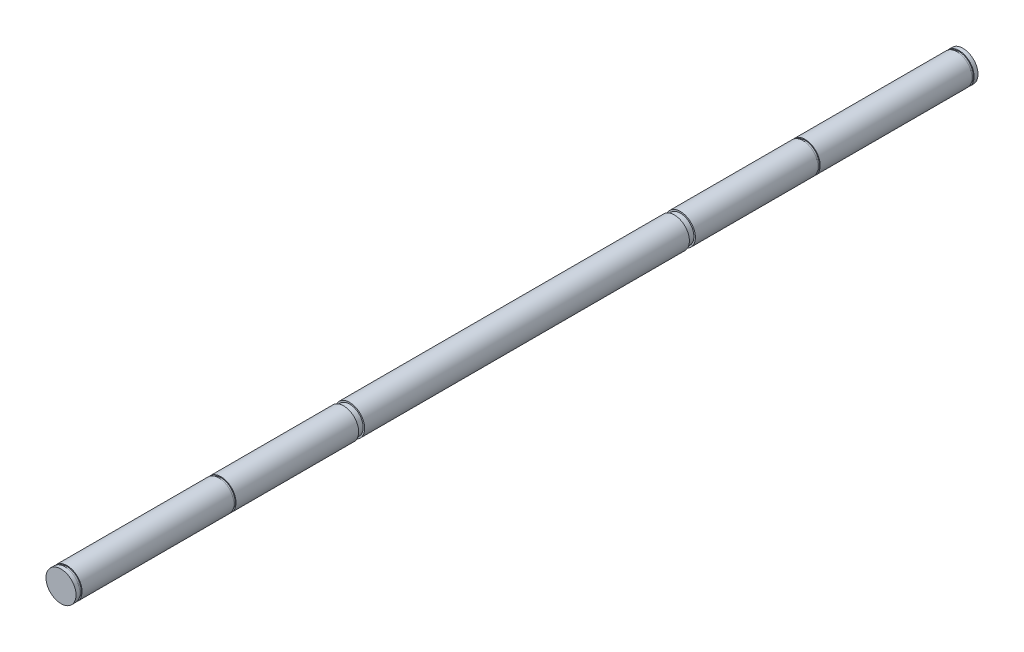
from build123d import *

# Parameters (mm, degrees)
SKETCH1_R           = 5
BOSS_EXTRUDE1_DEPTH = 150
CUT_EXTRUDE1_START  = 0.7
SKETCH2_R           = 5
SKETCH2_R_2         = 4.7
CUT_EXTRUDE1_DEPTH  = 0.7
SKETCH3_R           = 5
SKETCH3_R_2         = 4.7
CUT_EXTRUDE2_DEPTH  = 0.7
SKETCH4_R           = 5
SKETCH4_R_2         = 4.5
CUT_EXTRUDE3_DEPTH  = 1


with BuildPart() as part:
    # Sketch1 → Boss-Extrude1 (new, symmetric)
    with BuildSketch(Plane.XY):
        Circle(SKETCH1_R)
    extrude(amount=BOSS_EXTRUDE1_DEPTH, both=True)

    # Sketch2 → Cut-Extrude1 (cut)
    with BuildSketch(Plane.XY.offset(148).offset(CUT_EXTRUDE1_START)):
        Circle(SKETCH2_R)
        Circle(SKETCH2_R_2, mode=Mode.SUBTRACT)
    cut_extrude1 = extrude(amount=-CUT_EXTRUDE1_DEPTH, mode=Mode.SUBTRACT)

    # Sketch3 → Cut-Extrude2 (cut)
    with BuildSketch(Plane.XY.offset(97.5)):
        Circle(SKETCH3_R)
        Circle(SKETCH3_R_2, mode=Mode.SUBTRACT)
    cut_extrude2 = extrude(amount=-CUT_EXTRUDE2_DEPTH, mode=Mode.SUBTRACT)

    # Sketch4 → Cut-Extrude3 (cut, symmetric)
    with BuildSketch(Plane.XY.offset(55)):
        Circle(SKETCH4_R)
        Circle(SKETCH4_R_2, mode=Mode.SUBTRACT)
    cut_extrude3 = extrude(amount=CUT_EXTRUDE3_DEPTH, both=True, mode=Mode.SUBTRACT)

    # Mirror1: Cut-Extrude1, Cut-Extrude2, Cut-Extrude3 across plane
    add(cut_extrude1.mirror(Plane.XY), mode=Mode.SUBTRACT)
    add(cut_extrude2.mirror(Plane.XY), mode=Mode.SUBTRACT)
    add(cut_extrude3.mirror(Plane.XY), mode=Mode.SUBTRACT)


solid = part.part
